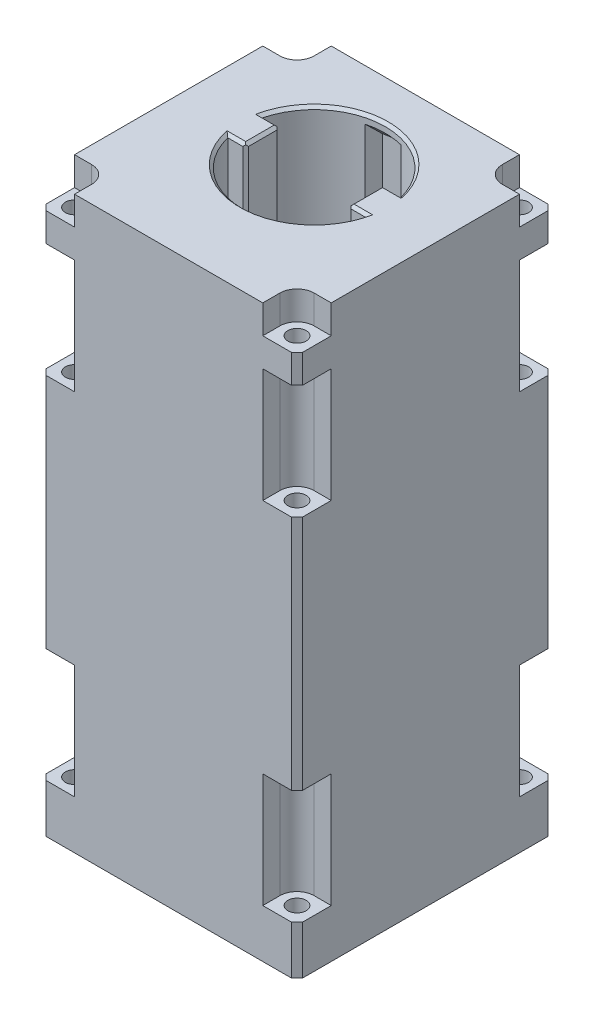
from build123d import *

# Parameters (mm, degrees)
SKETCH_1_W          = 45
SKETCH_1_H          = 39
SKETCH_1_R          = 12.5
EXTRUDE_1_DEPTH     = 100
SKETCH_2_W          = 6
SKETCH_2_H          = 6
EXTRUDE_2_DEPTH     = 100
SKETCH_3_W          = 45
SKETCH_3_H          = 100
EXTRUDE_3_DEPTH     = 6
SKETCH_4_R          = 1.6
CUT_EXTRUDE_1_DEPTH = 106.624334317
CUT_EXTRUDE_2_DEPTH = 5
CUT_EXTRUDE_4_DEPTH = 20
SKETCH_9_W          = 6.3
SKETCH_9_H          = 6.3
CUT_EXTRUDE_5_DEPTH = 95
CUT_EXTRUDE_START   = -20
CUT_EXTRUDE_6_DEPTH = 20
CHAMFER_1_SIZE      = 1
CHAMFER_2_SIZE      = 0.5
CHAMFER_3_SIZE      = 0.5
CHAMFER_4_SIZE      = 3.5


with BuildPart() as part:
    # 草图1 → 凸台-拉伸1 (new body)
    with BuildSketch(Plane(origin=(0, 0, 0), x_dir=(1, 0, 0), z_dir=(0, 1, 0))):
        Rectangle(SKETCH_1_W, SKETCH_1_H)
        with Locations(Location((0, 0, 0), (0, 0, 270))):
            Circle(SKETCH_1_R, mode=Mode.SUBTRACT)
    extrude(amount=EXTRUDE_1_DEPTH)

    # 草图2 → 凸台-拉伸2 (add)
    with BuildSketch(Plane(origin=(0, 100, 0), x_dir=(1, 0, 0), z_dir=(0, 1, 0))):
        with Locations((12, 0)):
            Rectangle(SKETCH_2_W, SKETCH_2_H)
        with Locations((-12, 0)):
            Rectangle(SKETCH_2_W, SKETCH_2_H)
    extrude(amount=-EXTRUDE_2_DEPTH)

    # 草图3 → 凸台-拉伸3 (add)
    with BuildSketch(Plane.XY.offset(19.5)):
        with Locations((0, 50)):
            Rectangle(SKETCH_3_W, SKETCH_3_H)
    extrude(amount=EXTRUDE_3_DEPTH)

    # 草图4 → 切除-拉伸1 (cut, through all)
    with BuildSketch(Plane(origin=(0, 100, 0), x_dir=(1, 0, 0), z_dir=(0, 1, 0))):
        with Locations(Location((-19.5, 16.5, 0), (0, 0, 270))):
            Circle(SKETCH_4_R)
        with Locations(Location((19.5, 16.5, 0), (0, 0, 90))):
            Circle(SKETCH_4_R)
        with Locations(Location((19.5, -22.5, 0), (0, 0, 270))):
            Circle(SKETCH_4_R)
        with Locations(Location((-19.5, -22.5, 0), (0, 0, 90))):
            Circle(SKETCH_4_R)
    extrude(amount=-CUT_EXTRUDE_1_DEPTH, mode=Mode.SUBTRACT)

    # 草图5 → 切除-拉伸2 (cut)
    with BuildSketch(Plane(origin=(0, 100, 0), x_dir=(1, 0, 0), z_dir=(0, 1, 0))):
        with BuildLine():
            Line((-19.5, 13.5), (-22.5, 13.5))
            Line((-22.5, 13.5), (-22.5, 19.5))
            Line((-22.5, 19.5), (-16.5, 19.5))
            Line((-16.5, 19.5), (-16.5, 16.5))
            ThreePointArc((-16.5, 16.5), (-17.378679656, 14.378679656), (-19.5, 13.5))
        make_face()
        with BuildLine():
            Line((22.5, 19.5), (16.5, 19.5))
            Line((16.5, 19.5), (16.5, 16.5))
            ThreePointArc((16.5, 16.5), (17.378679656, 14.378679656), (19.5, 13.5))
            Line((19.5, 13.5), (22.5, 13.5))
            Line((22.5, 13.5), (22.5, 19.5))
        make_face()
        with BuildLine():
            Line((22.5, -19.5), (22.5, -25.5))
            Line((22.5, -25.5), (16.5, -25.5))
            Line((16.5, -25.5), (16.5, -22.5))
            ThreePointArc((16.5, -22.5), (17.378679656, -20.378679656), (19.5, -19.5))
            Line((19.5, -19.5), (22.5, -19.5))
        make_face()
        with BuildLine():
            Line((-22.5, -25.5), (-16.5, -25.5))
            Line((-16.5, -25.5), (-16.5, -22.5))
            ThreePointArc((-16.5, -22.5), (-17.378679656, -20.378679656), (-19.5, -19.5))
            Line((-19.5, -19.5), (-22.5, -19.5))
            Line((-22.5, -19.5), (-22.5, -25.5))
        make_face()
    extrude(amount=-CUT_EXTRUDE_2_DEPTH, mode=Mode.SUBTRACT)

    # 草图8 → 切除-拉伸4 (cut)
    with BuildSketch(Plane(origin=(0, 90, 0), x_dir=(1, 0, 0), z_dir=(0, 1, 0))):
        with BuildLine():
            Line((-22.5, 13.5), (-19.5, 13.5))
            ThreePointArc((-19.5, 13.5), (-17.378679656, 14.378679656), (-16.5, 16.5))
            Line((-16.5, 16.5), (-16.5, 19.5))
            Line((-16.5, 19.5), (-22.5, 19.5))
            Line((-22.5, 19.5), (-22.5, 13.5))
        make_face()
        with BuildLine():
            Line((22.5, 19.5), (16.5, 19.5))
            Line((16.5, 19.5), (16.5, 16.5))
            ThreePointArc((16.5, 16.5), (17.378679656, 14.378679656), (19.5, 13.5))
            Line((19.5, 13.5), (22.5, 13.5))
            Line((22.5, 13.5), (22.5, 19.5))
        make_face()
        with BuildLine():
            Line((-22.5, -25.5), (-16.5, -25.5))
            Line((-16.5, -25.5), (-16.5, -22.5))
            ThreePointArc((-16.5, -22.5), (-17.378679656, -20.378679656), (-19.5, -19.5))
            Line((-19.5, -19.5), (-22.5, -19.5))
            Line((-22.5, -19.5), (-22.5, -25.5))
        make_face()
        with BuildLine():
            Line((16.5, -22.5), (16.5, -25.5))
            Line((16.5, -25.5), (22.5, -25.5))
            Line((22.5, -25.5), (22.5, -19.5))
            Line((22.5, -19.5), (19.5, -19.5))
            ThreePointArc((19.5, -19.5), (17.378679656, -20.378679656), (16.5, -22.5))
        make_face()
    extrude(amount=-CUT_EXTRUDE_4_DEPTH, mode=Mode.SUBTRACT)

    # 草图9 → 切除-拉伸5 (cut)
    with BuildSketch(Plane.XZ):
        with Locations((0, 12)):
            Rectangle(SKETCH_9_W, SKETCH_9_H)
        with Locations((0, -12)):
            Rectangle(SKETCH_9_W, SKETCH_9_H)
    extrude(amount=-CUT_EXTRUDE_5_DEPTH, mode=Mode.SUBTRACT)

    # 草图10 → 切除-拉伸6 (cut)
    with BuildSketch(Plane(origin=(0, 8.5, 0), x_dir=(-1, 0, 0), z_dir=(0, -1, 0)).offset(CUT_EXTRUDE_START)):
        with BuildLine():
            Line((-16.5, 19.5), (-22.5, 19.5))
            Line((-22.5, 19.5), (-22.5, 13.5))
            Line((-22.5, 13.5), (-19.5, 13.5))
            ThreePointArc((-19.5, 13.5), (-17.378679656, 14.378679656), (-16.5, 16.5))
            Line((-16.5, 16.5), (-16.5, 19.5))
        make_face()
        with BuildLine():
            Line((19.5, 13.5), (22.5, 13.5))
            Line((22.5, 13.5), (22.5, 19.5))
            Line((22.5, 19.5), (16.5, 19.5))
            Line((16.5, 19.5), (16.5, 16.5))
            ThreePointArc((16.5, 16.5), (17.378679656, 14.378679656), (19.5, 13.5))
        make_face()
        with BuildLine():
            Line((-16.5, -25.5), (-16.5, -22.5))
            ThreePointArc((-16.5, -22.5), (-17.378679656, -20.378679656), (-19.5, -19.5))
            Line((-19.5, -19.5), (-22.5, -19.5))
            Line((-22.5, -19.5), (-22.5, -25.5))
            Line((-22.5, -25.5), (-16.5, -25.5))
        make_face()
        with BuildLine():
            Line((22.5, -19.5), (19.5, -19.5))
            ThreePointArc((19.5, -19.5), (17.378679656, -20.378679656), (16.5, -22.5))
            Line((16.5, -22.5), (16.5, -25.5))
            Line((16.5, -25.5), (22.5, -25.5))
            Line((22.5, -25.5), (22.5, -19.5))
        make_face()
    extrude(amount=CUT_EXTRUDE_6_DEPTH, mode=Mode.SUBTRACT)

    # 倒角1
    chamfer_1_edges = [part.edges().sort_by_distance(p)[0] for p in [
        (-22.5, 92.5, -19.5),
        (22.5, 92.5, -19.5),
        (-22.5, 49.25, 25.5),
        (22.5, 92.5, 25.5),
        (-22.5, 49.25, -19.5),
        (22.5, 49.25, -19.5),
        (-22.5, 4.25, 25.5),
        (22.5, 49.25, 25.5),
        (-22.5, 4.25, -19.5),
        (22.5, 4.25, -19.5),
        (22.5, 4.25, 25.5),
        (-22.5, 92.5, 25.5),
    ]]
    chamfer(chamfer_1_edges, length=CHAMFER_1_SIZE)

    # 倒角2
    chamfer_2_edges = [part.edges().sort_by_distance(p)[0] for p in [
        (0, 100, -12.5),
        (8.893379874, 0, -8.783950957),
        (10.56733055, 100, 3),
        (10.56733055, 100, -3),
        (9, 100, 0),
        (10.56733055, 0, 3),
        (8.893379874, 0, 8.783950957),
        (9, 0, 0),
        (-8.893379874, 0, -8.783950957),
        (-3.15, 0, -13.623295214),
        (10.56733055, 0, -3),
        (3.15, 0, 13.623295214),
        (0, 0, 15.15),
        (-3.15, 0, 13.623295214),
        (3.15, 0, -13.623295214),
        (0, 0, -15.15),
        (-8.893379874, 0, 8.783950957),
        (0, 100, 12.5),
        (-10.56733055, 100, 3),
        (-9, 100, 0),
        (-10.56733055, 100, -3),
        (-10.56733055, 0, -3),
        (-9, 0, 0),
        (-10.56733055, 0, 3),
    ]]
    chamfer(chamfer_2_edges, length=CHAMFER_2_SIZE)

    # 倒角3
    chamfer_3_edges = [part.edges().sort_by_distance(p)[0] for p in [
        (9, 50, -3),
        (9, 50, 3),
        (-9, 50, 3),
        (-9, 50, -3),
    ]]
    chamfer(chamfer_3_edges, length=CHAMFER_3_SIZE)

    # 倒角4
    # the kernel refuses this chamfer: 3.5 mm, written as the material it takes off along each edge
    with BuildSketch(Plane(origin=(0, 95, 0), x_dir=(0.8276166143248335, 0, 0.5612938087076144), z_dir=(0.5612938087076144, 0, -0.8276166143248335))) as chamfer_4_piece_1_section:
        Polygon((12.5, -CHAMFER_4_SIZE), (12.5 + CHAMFER_4_SIZE, 0), (12.5, 0), align=None)
    chamfer_4_piece_1 = revolve(axis=Axis((0, 95, 0), (0, -1, 0)), revolution_arc=111.709358924, mode=Mode.PRIVATE)
    chamfer_4_piece_1 = split(chamfer_4_piece_1, bisect_by=Plane(origin=(3.15, 96.215607444, 13.411571033), z_dir=(-1, 0, 0)), keep=Keep.TOP, mode=Mode.PRIVATE)
    chamfer_4_piece_1 = split(chamfer_4_piece_1, bisect_by=Plane(origin=(0, 96.215607444, 15.15), z_dir=(0, 0, -1)), keep=Keep.TOP, mode=Mode.PRIVATE)
    chamfer_4_piece_1 = split(chamfer_4_piece_1, bisect_by=Plane(origin=(-3.15, 96.215607444, 13.411571033), z_dir=(1, 0, 0)), keep=Keep.TOP, mode=Mode.PRIVATE)
    add(chamfer_4_piece_1, mode=Mode.SUBTRACT)
    with BuildSketch(Plane(origin=(0, 95, 0), x_dir=(-0.8276166143248334, 0, -0.5612938087076144), z_dir=(-0.5612938087076144, 0, 0.8276166143248334))) as chamfer_4_piece_2_section:
        Polygon((12.5, -CHAMFER_4_SIZE), (12.5 + CHAMFER_4_SIZE, 0), (12.5, 0), align=None)
    chamfer_4_piece_2 = revolve(axis=Axis((0, 95, 0), (0, -1, 0)), revolution_arc=111.709358924, mode=Mode.PRIVATE)
    chamfer_4_piece_2 = split(chamfer_4_piece_2, bisect_by=Plane(origin=(3.15, 96.215607444, -13.411571033), z_dir=(-1, 0, 0)), keep=Keep.TOP, mode=Mode.PRIVATE)
    chamfer_4_piece_2 = split(chamfer_4_piece_2, bisect_by=Plane(origin=(0, 96.215607444, -15.15), z_dir=(0, 0, 1)), keep=Keep.TOP, mode=Mode.PRIVATE)
    chamfer_4_piece_2 = split(chamfer_4_piece_2, bisect_by=Plane(origin=(-3.15, 96.215607444, -13.411571033), z_dir=(1, 0, 0)), keep=Keep.TOP, mode=Mode.PRIVATE)
    add(chamfer_4_piece_2, mode=Mode.SUBTRACT)


solid = part.part
